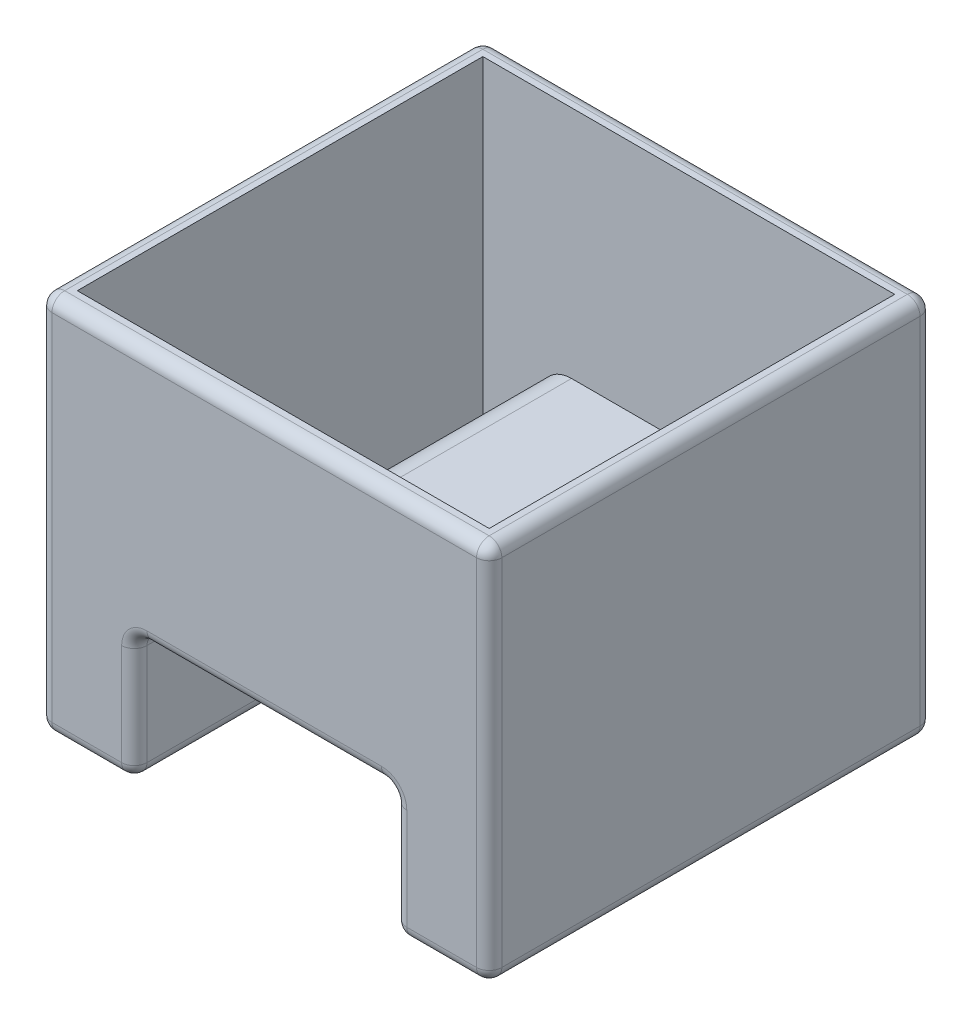
from build123d import *

# Parameters (mm, degrees)
BOSS_EXTRU_2_DEPTH = 70
CONG_4_R           = 2
CONG_3_R           = 2
CONG_5_R           = 2
CONG_6_R           = 2
COQUE1_START       = 3
COQUE1_DEPTH       = 64
CONG_7_R           = 2
CONG_8_R           = 2


# Read off the part's stored shape, not the designer's step: Coque1
with BuildPart() as part:
    # Esquisse2 → Boss.-Extru.2 (new body)
    with BuildSketch(Plane.XY):
        Polygon((-35.5, 0), (-20.5, 0), (-20.5, 20), (20.5, 20), (20.5, 0), (35.5, 0), (35.5, 60), (-35.5, 60), align=None)
    extrude(amount=BOSS_EXTRU_2_DEPTH)

    # Congé4
    cong_4_edges = [part.edges().sort_by_distance(p)[0] for p in [
        (-35.5, 60, 35),
    ]]
    fillet(cong_4_edges, radius=CONG_4_R)

    # Congé3
    cong_3_edges = [part.edges().sort_by_distance(p)[0] for p in [
        (35.5, 60, 35),
    ]]
    fillet(cong_3_edges, radius=CONG_3_R)

    # Congé5
    cong_5_edges = [part.edges().sort_by_distance(p)[0] for p in [
        (20.5, 20, 35),
    ]]
    fillet(cong_5_edges, radius=CONG_5_R)

    # Congé6
    cong_6_edges = [part.edges().sort_by_distance(p)[0] for p in [
        (-20.5, 20, 35),
    ]]
    fillet(cong_6_edges, radius=CONG_6_R)

    # Coque1 outline → Coque1 (cut)
    with BuildSketch(Plane.XY.offset(COQUE1_START)):
        with BuildLine():
            Line((-32.5, 60), (-32.5, 3))
            Line((-32.5, 3), (-23.5, 3))
            Line((-23.5, 3), (-23.5, 18))
            ThreePointArc((-23.5, 18), (-22.035533906, 21.535533906), (-18.5, 23))
            Line((-18.5, 23), (18.5, 23))
            ThreePointArc((18.5, 23), (22.035533906, 21.535533906), (23.5, 18))
            Line((23.5, 18), (23.5, 3))
            Line((23.5, 3), (32.5, 3))
            Line((32.5, 3), (32.5, 60))
            Line((32.5, 60), (-32.5, 60))
        make_face()
    extrude(amount=COQUE1_DEPTH, mode=Mode.SUBTRACT)

    # Congé7
    cong_7_edges = [part.edges().sort_by_distance(p)[0] for p in [
        (35.5, 29, 0),
        (34.914213562, 59.414213562, 0),
        (0, 60, 0),
        (-34.914213562, 59.414213562, 0),
        (-28, 0, 0),
        (-35.5, 0, 35),
        (-35.5, 29, 0),
    ]]
    fillet(cong_7_edges, radius=CONG_7_R)

    # Congé8
    cong_8_edges = [part.edges().sort_by_distance(p)[0] for p in [
        (-20.5, 9, 70),
        (35.5, 0, 36),
        (20.5, 0, 35),
        (-20.5, 0, 36),
        (28, 0, 70),
        (35.5, 29, 70),
        (-35.5, 30, 70),
        (-34.914213562, 59.414213562, 70),
        (0, 60, 70),
        (34.914213562, 59.414213562, 70),
        (20.5, 9, 0),
        (20.5, 9, 70),
        (19.914213562, 19.414213562, 0),
        (19.914213562, 19.414213562, 70),
        (0, 20, 0),
        (0, 20, 70),
        (-19.914213562, 19.414213562, 0),
        (-19.914213562, 19.414213562, 70),
        (-20.5, 10, 0),
        (34.914213562, 0, 0.585786438),
        (-27, 0, 70),
        (-20.5, 0.585786438, 0.585786438),
        (-34.914213562, 0.585786438, 70),
        (27, 0, 0),
    ]]
    fillet(cong_8_edges, radius=CONG_8_R)


solid = part.part
